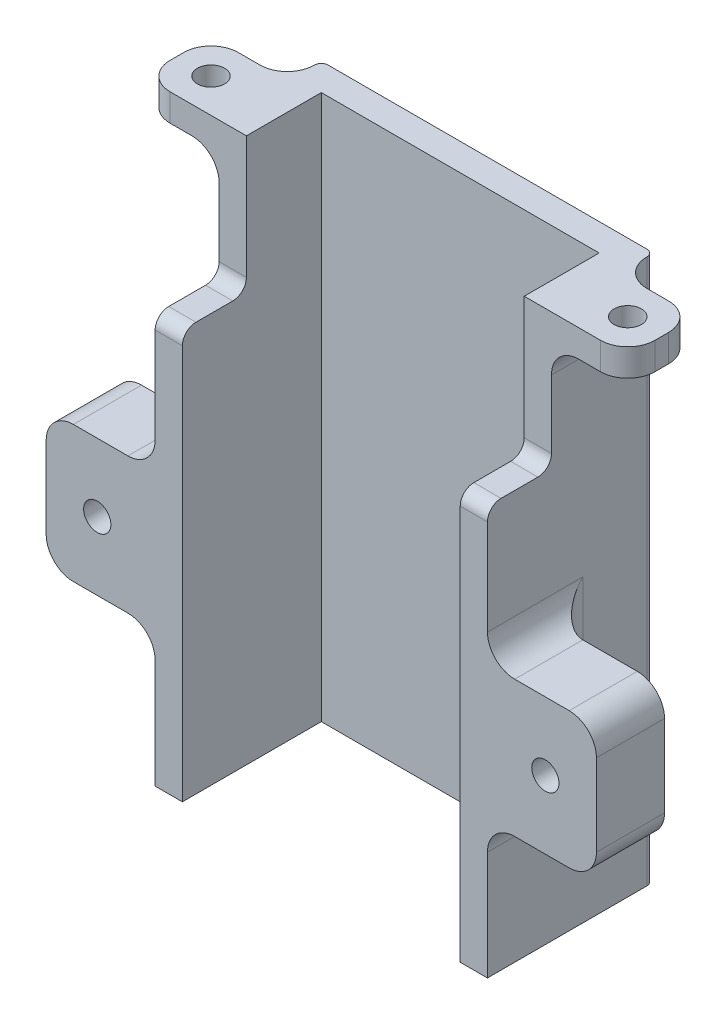
from build123d import *

# Parameters (mm, degrees)
BOSS_EXTRUDE1_DEPTH = 101.6
SKETCH2_W           = 25.4
SKETCH2_H           = 25.4
BOSS_EXTRUDE2_DEPTH = 12.7
SKETCH3_R           = 2.54
CUT_EXTRUDE1_DEPTH  = 116.280188272
SKETCH4_R           = 6.35
CUT_EXTRUDE2_DEPTH  = 5.08
FILLET1_R           = 5.08
SKETCH5_W           = 14.224
SKETCH5_H           = 12.7
SKETCH5_R           = 2.54
BOSS_EXTRUDE3_DEPTH = 5.08
FILLET2_R           = 5.08
FILLET3_R           = 5.08
SKETCH6_W           = 11.938
SKETCH6_H           = 25.4
CUT_EXTRUDE3_DEPTH  = 132.986426559
FILLET4_R           = 2.54
FILLET5_R           = 1.27


with BuildPart() as part:
    # Sketch1 → Boss-Extrude1 (new body)
    with BuildSketch(Plane(origin=(0, 0, 0), x_dir=(1, 0, 0), z_dir=(0, 1, 0))):
        Polygon((-25.908, -12.954), (-25.908, 12.954), (25.908, 12.954), (25.908, -12.954), (30.988, -12.954), (30.988, 18.034), (-30.988, 18.034), (-30.988, -12.954), align=None)
    extrude(amount=BOSS_EXTRUDE1_DEPTH)

    # Sketch2 → Boss-Extrude2 (add)
    with BuildSketch(Plane.XY.offset(12.954)):
        with Locations((38.608, 38.1)):
            Rectangle(SKETCH2_W, SKETCH2_H)
        with Locations((-38.608, 38.1)):
            Rectangle(SKETCH2_W, SKETCH2_H)
    extrude(amount=-BOSS_EXTRUDE2_DEPTH)

    # Sketch3 → Cut-Extrude1 (cut, through all)
    with BuildSketch(Plane(origin=(0, 0, 0.254), x_dir=(-1, 0, 0), z_dir=(0, 0, -1))):
        with Locations((-41.783, 38.1)):
            Circle(SKETCH3_R)
        with Locations(Location((41.783, 38.1, 0), (0, 0, 180))):
            Circle(SKETCH3_R)
    extrude(amount=-CUT_EXTRUDE1_DEPTH, mode=Mode.SUBTRACT)

    # Sketch4 → Cut-Extrude2 (cut)
    with BuildSketch(Plane(origin=(0, 0, 0.254), x_dir=(-1, 0, 0), z_dir=(0, 0, -1))):
        with Locations((-41.783, 38.1)):
            Circle(SKETCH4_R)
        with Locations((41.783, 38.1)):
            Circle(SKETCH4_R)
    extrude(amount=-CUT_EXTRUDE2_DEPTH, mode=Mode.SUBTRACT)

    # Fillet1
    fillet1_edges = [part.edges().sort_by_distance(p)[0] for p in [
        (51.308, 25.4, 6.604),
        (30.988, 50.8, 6.604),
        (51.308, 50.8, 6.604),
        (30.988, 25.4, 6.604),
        (30.988, 38.1, 0.254),
        (-30.988, 25.4, 6.604),
        (-51.308, 25.4, 6.604),
        (-30.988, 50.8, 6.604),
        (-51.308, 50.8, 6.604),
        (-30.988, 38.1, 0.254),
    ]]
    fillet(fillet1_edges, radius=FILLET1_R)

    # Sketch5 → Boss-Extrude3 (add)
    # profile 1 of 2: a face of its own
    with BuildSketch(Plane(origin=(0, 101.6, 0), x_dir=(1, 0, 0), z_dir=(0, 1, 0))):
        with Locations((38.1, 5.334)):
            Rectangle(SKETCH5_W, SKETCH5_H)
        with Locations(Location((38.862, 5.334, 0), (0, 0, 270))):
            Circle(SKETCH5_R, mode=Mode.SUBTRACT)
    # profile 2 of 2: a face of its own
    with BuildSketch(Plane(origin=(0, 101.6, 0), x_dir=(1, 0, 0), z_dir=(0, 1, 0))):
        with Locations((-38.1, 5.334)):
            Rectangle(SKETCH5_W, SKETCH5_H)
        with Locations(Location((-38.862, 5.334, 0), (0, 0, 270))):
            Circle(SKETCH5_R, mode=Mode.SUBTRACT)
    extrude(amount=-BOSS_EXTRUDE3_DEPTH)

    # Fillet2
    fillet2_edges = [part.edges().sort_by_distance(p)[0] for p in [
        (-30.988, 99.06, -11.684),
        (-30.988, 96.52, -5.334),
        (30.988, 99.06, -11.684),
        (30.988, 96.52, -5.334),
    ]]
    fillet(fillet2_edges, radius=FILLET2_R)

    # Fillet3
    fillet3_edges = [part.edges().sort_by_distance(p)[0] for p in [
        (-45.212, 99.06, -11.684),
        (-45.212, 99.06, 1.016),
        (45.212, 99.06, -11.684),
        (45.212, 99.06, 1.016),
    ]]
    fillet(fillet3_edges, radius=FILLET3_R)

    # Sketch6 → Cut-Extrude3 (cut, through all)
    with BuildSketch(Plane.ZY.offset(30.988)):
        with Locations((6.985, 88.9)):
            Rectangle(SKETCH6_W, SKETCH6_H)
    extrude(amount=-CUT_EXTRUDE3_DEPTH, mode=Mode.SUBTRACT)

    # Fillet4
    fillet4_edges = [part.edges().sort_by_distance(p)[0] for p in [
        (28.448, 76.2, 12.954),
        (28.448, 76.2, 1.016),
        (-28.448, 76.2, 1.016),
        (-28.448, 76.2, 12.954),
    ]]
    fillet(fillet4_edges, radius=FILLET4_R)

    # Fillet5
    fillet5_edges = [part.edges().sort_by_distance(p)[0] for p in [
        (30.988, 50.8, -18.034),
        (-30.988, 50.8, -18.034),
    ]]
    fillet(fillet5_edges, radius=FILLET5_R - 0.0001)  # a hair under: the kernel refuses the full size


solid = part.part
